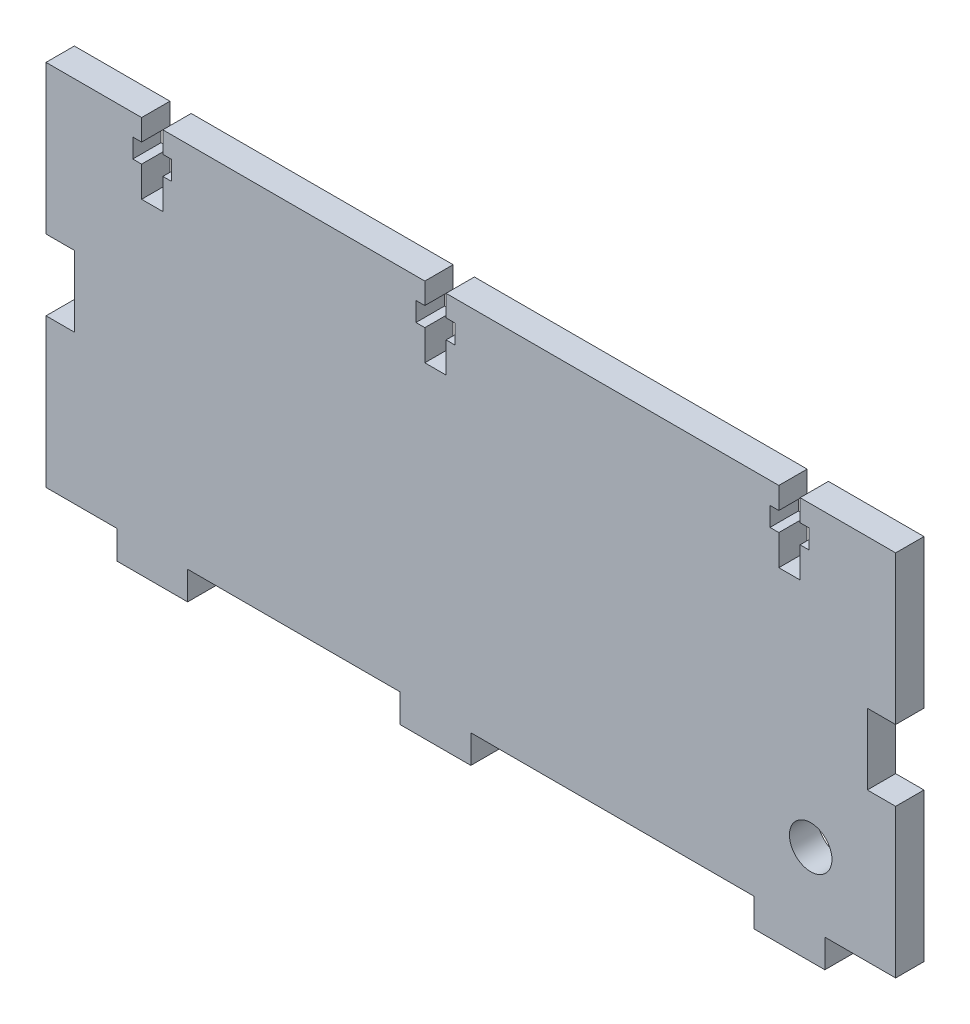
from build123d import *

# Parameters (mm, degrees)
SKETCH1_R           = 3
BOSS_EXTRUDE1_DEPTH = 4
CUT_EXTRUDE1_DEPTH  = 4


with BuildPart() as part:
    # Sketch1 → Boss-Extrude1 (new body)
    with BuildSketch(Plane.XY):
        Polygon((0, 21), (0, 0), (10, 0), (10, -4), (20, -4), (20, 0), (50, 0), (50, -4), (60, -4), (60, 0), (100, 0), (100, -4), (110, -4), (110, 0), (120, 0), (120, 21), (116, 21), (116, 31), (120, 31), (120, 52), (110, 52), (100, 52), (60, 52), (50, 52), (20, 52), (10, 52), (0, 52), (0, 31), (4, 31), (4, 21), align=None)
        with Locations((108, 10)):
            Circle(SKETCH1_R, mode=Mode.SUBTRACT)
    extrude(amount=BOSS_EXTRUDE1_DEPTH)

    # Sketch2 → Cut-Extrude1 (cut)
    with BuildSketch(Plane.XY.offset(4)):
        Polygon((13.5, 52), (16.5, 52), (16.5, 49), (17.75, 49), (17.75, 46.3), (16.5, 46.3), (16.5, 42), (13.5, 42), (13.5, 46.3), (12.25, 46.3), (12.25, 49), (13.5, 49), align=None)
        Polygon((53.5, 52), (56.5, 52), (56.5, 49), (57.75, 49), (57.75, 46.3), (56.5, 46.3), (56.5, 42), (53.5, 42), (53.5, 46.3), (52.25, 46.3), (52.25, 49), (53.5, 49), align=None)
        Polygon((103.5, 52), (106.5, 52), (106.5, 48.937215832), (107.75, 48.937215832), (107.75, 46.237215832), (106.5, 46.237215832), (106.5, 41.937215832), (103.5, 41.937215832), (103.5, 46.237215832), (102.25, 46.237215832), (102.25, 48.937215832), (103.5, 48.937215832), align=None)
    extrude(amount=-CUT_EXTRUDE1_DEPTH, mode=Mode.SUBTRACT)


solid = part.part
